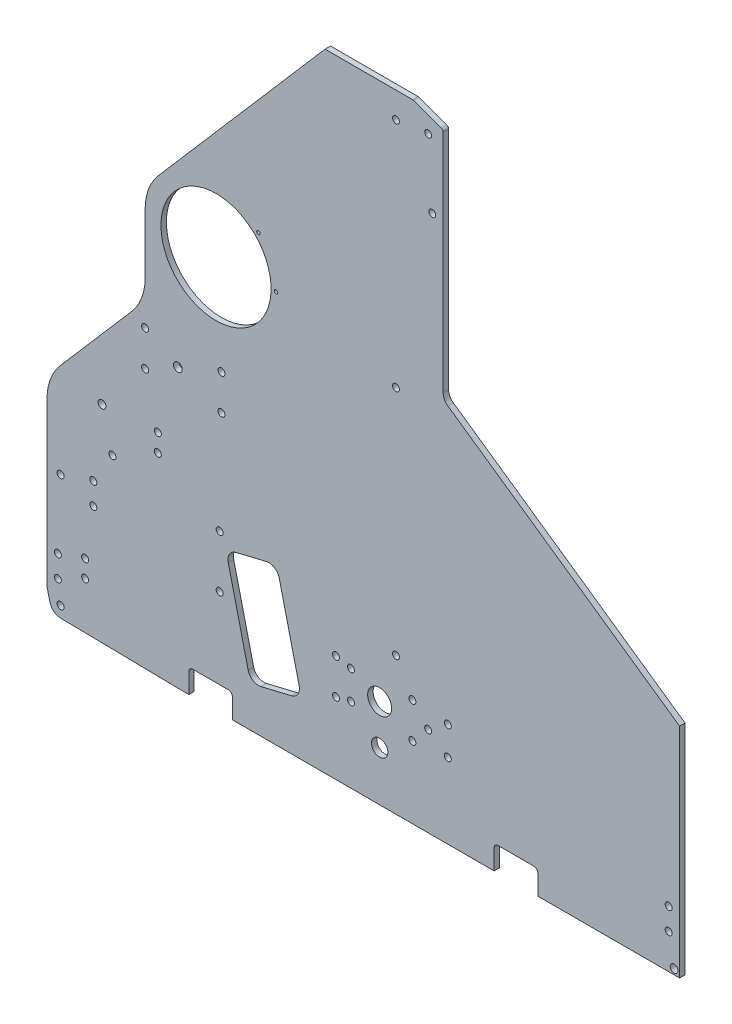
from build123d import *

# Parameters (mm, degrees)
SKETCH1_R           = 2.032
SKETCH1_R_2         = 2.54
SKETCH1_R_3         = 2
BOSS_EXTRUDE1_DEPTH = 3.175
FILLET1_R           = 2.286
FILLET2_R           = 6.35
SKETCH2_R           = 2.032
CUT_EXTRUDE1_DEPTH  = 505.524983177
FILLET3_R           = 1.5875
SKETCH3_R           = 2.032
SKETCH3_R_2         = 2.286
SKETCH3_R_3         = 1.016
CUT_EXTRUDE2_DEPTH  = 505.524983177
SKETCH4_R           = 2.032
SKETCH4_R_2         = 6.985
SKETCH4_R_3         = 4.7625
CUT_EXTRUDE3_DEPTH  = 505.524983177
SKETCH5_R           = 32.0675
SKETCH5_R_2         = 2.286
CUT_EXTRUDE5_DEPTH  = 540.282512256
FILLET4_R           = 31.75


with BuildPart() as part:
    # Sketch1 → Boss-Extrude1 (new body)
    with BuildSketch(Plane.XY):
        with BuildLine():
            Line((7.829508682, -19.049081656), (82.55, -20.32))
            Line((82.55, -20.32), (82.55, -6.35))
            Line((82.55, -6.35), (107.95, -6.35))
            Line((107.95, -6.35), (107.95, -20.32))
            Line((107.95, -20.32), (260.35, -20.32))
            Line((260.35, -20.32), (260.35, -6.35))
            Line((260.35, -6.35), (285.75, -6.35))
            Line((285.75, -6.35), (285.75, -20.32))
            Line((285.75, -20.32), (368.3, -20.32))
            Line((368.3, -20.32), (368.3, 106.68))
            Line((368.3, 106.68), (230.66375, 202.565))
            Line((230.66375, 202.565), (230.66375, 338.455))
            Line((230.66375, 338.455), (213.19998, 344.805))
            Line((213.19998, 344.805), (203.2, 344.805))
            Line((203.2, 344.805), (161.925, 344.805))
            Line((161.925, 344.805), (52.720122664, 218.469945827))
            ThreePointArc((52.720122664, 218.469945827), (52.803835479, 218.142145922), (52.832, 217.805))
            ThreePointArc((52.832, 217.805), (52.095493096, 216.239521914), (50.419872403, 215.808871996))
            Line((50.419872403, 215.808871996), (0, 157.48))
            Line((0, 157.48), (0, 0))
            Line((0, 0), (0, -6.35))
            ThreePointArc((0, -6.35), (0.047577015, -7.125863724), (0.189595124, -7.890101219))
            Line((0.189595124, -7.890101219), (1.777095124, -14.240101219))
            ThreePointArc((1.777095124, -14.240101219), (3.987212552, -17.671692778), (7.829508682, -19.049081656))
        make_face()
        with Locations((7.9375, -12.7)):
            Circle(SKETCH1_R, mode=Mode.SUBTRACT)
        with Locations((6.35, 0)):
            Circle(SKETCH1_R, mode=Mode.SUBTRACT)
        with Locations((6.35, 12.7)):
            Circle(SKETCH1_R, mode=Mode.SUBTRACT)
        with Locations((38.1, 78.105)):
            Circle(SKETCH1_R, mode=Mode.SUBTRACT)
        with Locations((57.15, 131.28625)):
            Circle(SKETCH1_R, mode=Mode.SUBTRACT)
        with Locations((57.15, 151.92375)):
            Circle(SKETCH1_R, mode=Mode.SUBTRACT)
        with Locations((76.2, 141.605)):
            Circle(SKETCH1_R_2, mode=Mode.SUBTRACT)
        with Locations((101.6, 131.28625)):
            Circle(SKETCH1_R, mode=Mode.SUBTRACT)
        with Locations((101.6, 151.92375)):
            Circle(SKETCH1_R, mode=Mode.SUBTRACT)
        with Locations((203.2, 59.805)):
            Circle(SKETCH1_R_3, mode=Mode.SUBTRACT)
        with Locations((361.95, 0)):
            Circle(SKETCH1_R, mode=Mode.SUBTRACT)
        with Locations((361.95, 12.7)):
            Circle(SKETCH1_R, mode=Mode.SUBTRACT)
        with Locations((76.2, 217.805)):
            Circle(SKETCH1_R, mode=Mode.SUBTRACT)
        with Locations((203.2, 194.805)):
            Circle(SKETCH1_R_3, mode=Mode.SUBTRACT)
        with Locations((224.31375, 293.243)):
            Circle(SKETCH1_R, mode=Mode.SUBTRACT)
        with Locations((203.2, 329.805)):
            Circle(SKETCH1_R_3, mode=Mode.SUBTRACT)
        with Locations((221.931865, 332.105)):
            Circle(SKETCH1_R_3, mode=Mode.SUBTRACT)
    extrude(amount=BOSS_EXTRUDE1_DEPTH)

    # Fillet1
    fillet1_edges = [part.edges().sort_by_distance(p)[0] for p in [
        (285.75, -6.35, 1.5875),
        (107.95, -6.35, 1.5875),
        (260.35, -6.35, 1.5875),
        (82.55, -6.35, 1.5875),
    ]]
    fillet(fillet1_edges, radius=FILLET1_R)

    # Fillet2
    fillet2_edges = [part.edges().sort_by_distance(p)[0] for p in [
        (230.66375, 202.565, 1.5875),
    ]]
    fillet(fillet2_edges, radius=FILLET2_R)

    # Sketch2 → Cut-Extrude1 (cut, through all)
    with BuildSketch(Plane(origin=(0, 0, 0), x_dir=(-1, 0, 0), z_dir=(0, 0, -1))):
        with Locations((-100.552770272, 71.086035298)):
            Circle(SKETCH2_R)
        with Locations((-100.552770272, 40.606035298)):
            Circle(SKETCH2_R)
        with Locations((-22.225, 18.202541089)):
            Circle(SKETCH2_R)
        with Locations((-22.225, 8.042541089)):
            Circle(SKETCH2_R)
    extrude(amount=-CUT_EXTRUDE1_DEPTH, mode=Mode.SUBTRACT)

    # Fillet3
    fillet3_edges = [part.edges().sort_by_distance(p)[0] for p in [
        (230.66375, 338.455, 1.5875),
        (213.19998, 344.805, 1.5875),
    ]]
    fillet(fillet3_edges, radius=FILLET3_R)

    # Sketch3 → Cut-Extrude2 (cut, through all)
    with BuildSketch(Plane.XY.offset(3.175)):
        with BuildLine():
            Line((127.789350211, 69.359774106), (110.090750339, 65.117184968))
            ThreePointArc((110.090750339, 65.117184968), (106.287939856, 62.356288953), (105.55119507, 57.715047577))
            Line((105.55119507, 57.715047577), (117.160037875, 9.287010566))
            ThreePointArc((117.160037875, 9.287010566), (119.92093389, 5.484200083), (124.562175266, 4.747455297))
            Line((124.562175266, 4.747455297), (142.260775137, 8.990044434))
            ThreePointArc((142.260775137, 8.990044434), (146.063585621, 11.75094045), (146.800330407, 16.392181825))
            Line((146.800330407, 16.392181825), (135.191487602, 64.820218836))
            ThreePointArc((135.191487602, 64.820218836), (132.430591586, 68.62302932), (127.789350211, 69.359774106))
        make_face()
        with Locations((26.987500002, 46.953113935)):
            Circle(SKETCH3_R)
        with Locations((26.987500002, 59.653113935)):
            Circle(SKETCH3_R)
        with Locations((7.937500002, 53.303113935)):
            Circle(SKETCH3_R)
        with Locations((32.030600738, 100.810868776)):
            Circle(SKETCH3_R_2)
        with Locations((64.525942114, 102.94048958)):
            Circle(SKETCH3_R)
        with Locations((64.525942114, 92.525786339)):
            Circle(SKETCH3_R)
        with Locations((133.35, 208.228121768)):
            Circle(SKETCH3_R_3)
        with Locations((123.120704333, 232.923826101)):
            Circle(SKETCH3_R_3)
    extrude(amount=-CUT_EXTRUDE2_DEPTH, mode=Mode.SUBTRACT)

    # Sketch4 → Cut-Extrude3 (cut, through all)
    with BuildSketch(Plane.XY.offset(3.175)):
        with Locations((168.275, 42.06875)):
            Circle(SKETCH4_R)
        with Locations((212.725, 42.06875)):
            Circle(SKETCH4_R)
        with Locations((212.725, 21.43125)):
            Circle(SKETCH4_R)
        with Locations((168.275, 21.43125)):
            Circle(SKETCH4_R)
        with Locations((193.675, 31.75)):
            Circle(SKETCH4_R_2)
        with Locations((177.00498, 40.0431)):
            Circle(SKETCH4_R)
        with Locations((177.00498, 23.4569)):
            Circle(SKETCH4_R)
        with Locations((193.675, 8.466666658)):
            Circle(SKETCH4_R_3)
        with Locations((221.931865, 31.75)):
            Circle(SKETCH4_R)
        with Locations((233.36123, 23.4569)):
            Circle(SKETCH4_R)
        with Locations((233.36123, 40.0431)):
            Circle(SKETCH4_R)
    extrude(amount=-CUT_EXTRUDE3_DEPTH, mode=Mode.SUBTRACT)

    # Sketch5 → Cut-Extrude5 (cut, through all)
    with BuildSketch(Plane(origin=(0, 0, -187.325), x_dir=(-1, 0, 0), z_dir=(0, 0, -1))):
        Polygon((0, 157.48), (-57.15, 223.594705882), (-57.15, 165.333696112), (0, 99.218990229), align=None)
        with Locations((-98.425, 208.228121768)):
            Circle(SKETCH5_R)
        with Locations((-365.125, -17.145)):
            Circle(SKETCH5_R_2)
    extrude(amount=-CUT_EXTRUDE5_DEPTH, mode=Mode.SUBTRACT)

    # Fillet4
    fillet4_edges = [part.edges().sort_by_distance(p)[0] for p in [
        (0, 99.218990229, 1.5875),
        (57.15, 165.333696112, 1.5875),
        (57.15, 223.594705882, 1.5875),
    ]]
    fillet(fillet4_edges, radius=FILLET4_R)


solid = part.part
